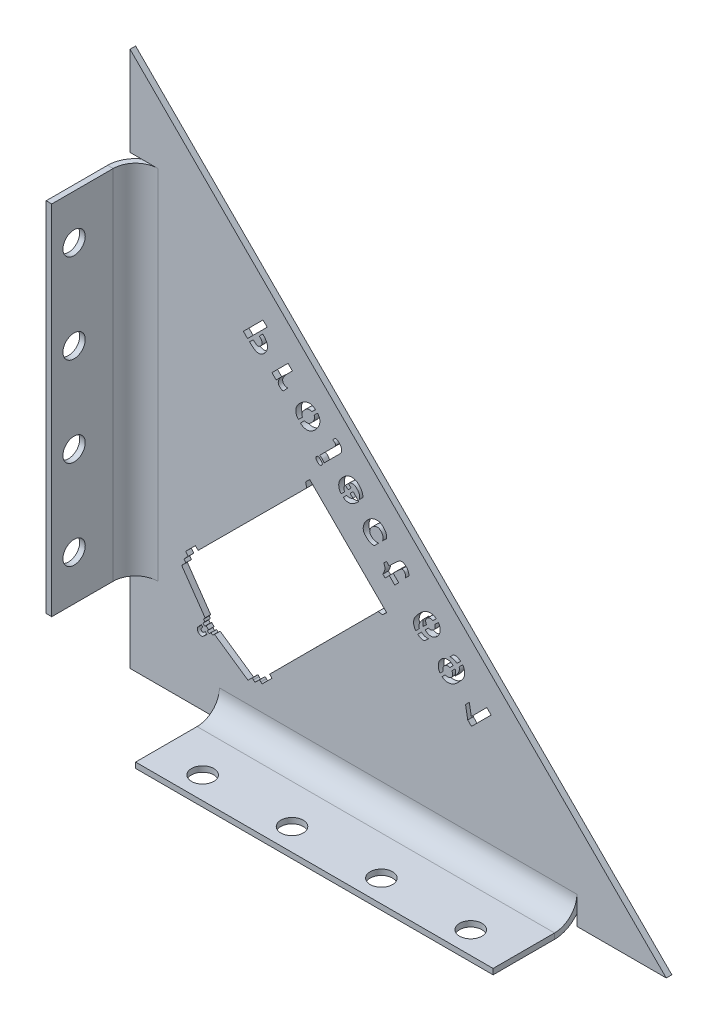
from build123d import *

# Parameters (mm, degrees)
BOSS_EXTRUDE1_DEPTH          = 1.5875
SKETCH7_W                    = 1.5875
SKETCH7_H                    = 101.6
BOSS_EXTRUDE2_DEPTH          = 0.0254
EDGE_FLANGE1_STRIP_W         = 19.05
EDGE_FLANGE1_STRIP_H         = 1.5875
EDGE_FLANGE1_STRIP_CUT_DEPTH = 101.6
EDGE_FLANGE1_DEPTH           = 101.6
SKETCH11_W                   = 101.6
SKETCH11_H                   = 1.5875
BOSS_EXTRUDE3_DEPTH          = 0.0254
EDGE_FLANGE2_STRIP_W         = 19.05
EDGE_FLANGE2_STRIP_H         = 1.5875
EDGE_FLANGE2_STRIP_CUT_DEPTH = 101.6
EDGE_FLANGE2_DEPTH           = 101.6
SKETCH15_R                   = 3.175
CUT_EXTRUDE1_DEPTH           = 2.54
SKETCH16_R                   = 3.175
CUT_EXTRUDE2_DEPTH           = 2.54
CUT_EXTRUDE4_DEPTH           = 2.54
CUT_EXTRUDE7_DEPTH           = 2.54
CUT_EXTRUDE11_DEPTH          = 2.54


# Sheet-metal steps are written as plain solids
with BuildPart() as part:
    # Sketch1 → Boss-Extrude1 (new body)
    with BuildSketch(Plane.XY):
        Polygon((0, 119.481843199), (0, -32.918156801), (152.4, -32.918156801), align=None)
    extrude(amount=BOSS_EXTRUDE1_DEPTH)

    # Sketch7 → Boss-Extrude2 (add)
    with BuildSketch(Plane.ZY):
        with Locations((0.79375, 43.281843199)):
            Rectangle(SKETCH7_W, SKETCH7_H)
    extrude(amount=BOSS_EXTRUDE2_DEPTH)

    # Edge-Flange1 strip (across the edge) → Edge-Flange1 strip cut (cut)
    with BuildSketch(Plane(origin=(-0.0254, 94.081843199, 1.5875), x_dir=(1, 0, 0), z_dir=(0, -1, 0))):
        with Locations((-1.5875, -0.79375)):
            Rectangle(EDGE_FLANGE1_STRIP_W, EDGE_FLANGE1_STRIP_H)
    extrude(amount=EDGE_FLANGE1_STRIP_CUT_DEPTH, mode=Mode.SUBTRACT)

    # Edge-Flange1 section (across the edge) → Edge-Flange1 (add)
    with BuildSketch(Plane(origin=(-0.0254, 94.081843199, 1.5875), x_dir=(1, 0, 0), z_dir=(0, -1, 0))):
        with BuildLine():
            Line((0, 6.35), (0, 23.8125))
            Line((0, 23.8125), (1.5875, 23.8125))
            Line((1.5875, 23.8125), (1.5875, 6.35))
            ThreePointArc((1.5875, 6.35), (3.447371939, 1.859871939), (7.9375, 0))
            Line((7.9375, 0), (7.9375, -1.5875))
            ThreePointArc((7.9375, -1.5875), (2.324839924, 0.737339924), (0, 6.35))
        make_face()
    extrude(amount=EDGE_FLANGE1_DEPTH)

    # Sketch11 → Boss-Extrude3 (add)
    with BuildSketch(Plane(origin=(0, -32.918156801, 0), x_dir=(-1, 0, 0), z_dir=(0, -1, 0))):
        with Locations((-76.2, -0.79375)):
            Rectangle(SKETCH11_W, SKETCH11_H)
    extrude(amount=BOSS_EXTRUDE3_DEPTH)

    # Edge-Flange2 strip (across the edge) → Edge-Flange2 strip cut (cut)
    with BuildSketch(Plane(origin=(25.4, -32.943556801, 1.5875), x_dir=(0, 1, 0), z_dir=(1, 0, 0))):
        with Locations((-1.5875, -0.79375)):
            Rectangle(EDGE_FLANGE2_STRIP_W, EDGE_FLANGE2_STRIP_H)
    extrude(amount=EDGE_FLANGE2_STRIP_CUT_DEPTH, mode=Mode.SUBTRACT)

    # Edge-Flange2 section (across the edge) → Edge-Flange2 (add)
    with BuildSketch(Plane(origin=(25.4, -32.943556801, 1.5875), x_dir=(0, 1, 0), z_dir=(1, 0, 0))):
        with BuildLine():
            Line((0, 6.35), (0, 23.8125))
            Line((0, 23.8125), (1.5875, 23.8125))
            Line((1.5875, 23.8125), (1.5875, 6.35))
            ThreePointArc((1.5875, 6.35), (3.447371939, 1.859871939), (7.9375, 0))
            Line((7.9375, 0), (7.9375, -1.5875))
            ThreePointArc((7.9375, -1.5875), (2.324839924, 0.737339924), (0, 6.35))
        make_face()
    extrude(amount=EDGE_FLANGE2_DEPTH)

    # Sketch15 → Cut-Extrude1 (cut)
    with BuildSketch(Plane(origin=(0, -31.356056801, 0), x_dir=(1, 0, 0), z_dir=(0, 1, 0))):
        with Locations(Location((38.1, -19.05, 0), (0, 0, 270))):
            Circle(SKETCH15_R)
        with Locations(Location((63.5, -19.05, 0), (0, 0, 270))):
            Circle(SKETCH15_R)
        with Locations(Location((88.9, -19.05, 0), (0, 0, 270))):
            Circle(SKETCH15_R)
        with Locations(Location((114.3, -19.05, 0), (0, 0, 270))):
            Circle(SKETCH15_R)
    extrude(amount=-CUT_EXTRUDE1_DEPTH, mode=Mode.SUBTRACT)

    # Sketch16 → Cut-Extrude2 (cut)
    with BuildSketch(Plane(origin=(1.5621, 0, 0), x_dir=(0, 0, -1), z_dir=(1, 0, 0))):
        with Locations((-19.05, 81.381843199)):
            Circle(SKETCH16_R)
        with Locations((-19.05, 55.981843199)):
            Circle(SKETCH16_R)
        with Locations((-19.05, 30.581843199)):
            Circle(SKETCH16_R)
        with Locations((-19.05, 5.181843199)):
            Circle(SKETCH16_R)
    extrude(amount=-CUT_EXTRUDE2_DEPTH, mode=Mode.SUBTRACT)

    # Sketch19 → Cut-Extrude4 (cut)
    with BuildSketch(Plane(origin=(0, 0, 0), x_dir=(-1, 0, 0), z_dir=(0, 0, -1))):
        with BuildLine():
            add(Edge.make_bspline(
                [(-54.451629709, 44.308400165), (-54.486216356, 44.347097669), (-54.552844966, 44.421645541), (-54.619431381, 44.554473369), (-54.644885888, 44.696657055), (-54.635652404, 44.845922248), (-54.586551979, 45.002877848), (-54.494039294, 45.164239512), (-54.370016404, 45.338062039), (-54.208899848, 45.506933329), (-54.038541356, 45.667558131), (-53.86728466, 45.796755143), (-53.705735912, 45.89260812), (-53.550339865, 45.947667342), (-53.401150145, 45.968395547), (-53.258558385, 45.944748504), (-53.125321358, 45.881598423), (-53.008521132, 45.783078955), (-52.908409106, 45.665084526), (-52.844147531, 45.525943286), (-52.818369511, 45.375023534), (-52.829681514, 45.214256535), (-52.880338366, 45.048503358), (-52.965261587, 44.877991305), (-53.089546945, 44.707389018), (-53.242168849, 44.54028881), (-53.406291032, 44.385842409), (-53.576008153, 44.2647164), (-53.738514348, 44.175383143), (-53.897071431, 44.122809093), (-54.050611902, 44.109146281), (-54.197235932, 44.13527054), (-54.333892833, 44.204126421), (-54.411237162, 44.272626479), (-54.451629709, 44.308400165)],
                knots=[0, 0, 0, 0, 0.89096093, 1.716370149, 2.519710242, 3.350237323, 4.268177873, 5.323688382, 6.539873258, 7.936784, 9.333694741, 10.567414482, 11.623893583, 12.554062634, 13.388976487, 14.188914126, 15.005781945, 15.896742875, 16.80159031, 17.649470878, 18.50136307, 19.41130979, 20.398285583, 21.466456066, 22.676900497, 24.018679477, 25.359804904, 26.548445057, 27.599284631, 28.541936938, 29.403380809, 30.226130366, 31.073608727, 32, 32, 32, 32], degree=3))
        make_face()
        Polygon((-97.041095461, 1.333701079), (-102.620099628, 6.912705246), (-101.390448586, 8.142356288), (-96.99810067, 3.750008371), (-96.421970461, 6.953980246), (-95.359139211, 5.891148996), (-95.98686317, 2.387933371), align=None)
        with BuildLine():
            Line((-93.953304581, 15.81339196), (-92.890473331, 14.75056071))
            add(Edge.make_bspline(
                [(-92.890473331, 14.75056071), (-92.827020703, 14.81059733), (-92.701447887, 14.929409864), (-92.492119234, 15.078359799), (-92.271478041, 15.202284832), (-92.037393519, 15.299625522), (-91.78672288, 15.368897662), (-91.518953423, 15.409021657), (-91.2324372, 15.423864597), (-91.036488157, 15.409695365), (-90.935070206, 15.402361752)],
                knots=[0, 0, 0, 0, 0.980817489, 1.941038821, 2.878509081, 3.820198868, 4.783140073, 5.793726477, 6.858092202, 8, 8, 8, 8], degree=3))
            Line((-90.935070206, 15.402361752), (-91.939428539, 16.406720085))
            add(Edge.make_bspline(
                [(-91.939428539, 16.406720085), (-91.993165972, 16.418939645), (-92.098857026, 16.442973138), (-92.258077532, 16.465620673), (-92.414584879, 16.474358391), (-92.568844285, 16.46923621), (-92.720262944, 16.450371927), (-92.868851097, 16.4176688), (-93.014099424, 16.370516387), (-93.198067554, 16.293917403), (-93.407190155, 16.189744697), (-93.627185453, 16.062698213), (-93.809767033, 15.943255505), (-93.908336009, 15.854076633), (-93.953304581, 15.81339196)],
                knots=[0, 0, 0, 0, 0.906066358, 1.782055884, 2.641294935, 3.480860537, 4.316978217, 5.147335385, 5.979189849, 6.824821184, 8.422826787, 9.816763711, 11.003976472, 12, 12, 12, 12], degree=3))
        make_face()
        with BuildLine():
            Line((-91.829361872, 13.689449252), (-90.900674372, 12.760761752))
            add(Edge.make_bspline(
                [(-90.900674372, 12.760761752), (-90.865046013, 12.778612267), (-90.786299141, 12.818066014), (-90.643909555, 12.853690463), (-90.471358878, 12.873514374), (-90.272722226, 12.884591741), (-90.054211337, 12.864226473), (-89.832377466, 12.782128668), (-89.616102321, 12.645750751), (-89.412378329, 12.464567674), (-89.229701124, 12.262953791), (-89.081677229, 12.05560123), (-88.978372056, 11.848737195), (-88.922837448, 11.643694736), (-88.90655937, 11.446448819), (-88.916750773, 11.259190232), (-88.961433038, 11.081178039), (-89.015975628, 10.974184384), (-89.043299372, 10.920584668)],
                knots=[0, 0, 0, 0, 0.572085397, 1.26444038, 2.09625672, 3.070483045, 4.124420694, 5.228059518, 6.43908216, 7.783856681, 9.138863522, 10.347129936, 11.439116606, 12.447625815, 13.383377729, 14.276112387, 15.136398451, 16, 16, 16, 16], degree=3))
            Line((-89.043299372, 10.920584668), (-88.123210831, 10.000496127))
            add(Edge.make_bspline(
                [(-88.123210831, 10.000496127), (-88.082613908, 10.04548828), (-88.000236962, 10.136783776), (-87.893894157, 10.292878584), (-87.809570633, 10.470904124), (-87.736046463, 10.66546123), (-87.683128216, 10.88049402), (-87.639940334, 11.113416514), (-87.620970711, 11.366235546), (-87.609935458, 11.632628123), (-87.623929923, 11.904280281), (-87.660394655, 12.17257981), (-87.72704783, 12.430825807), (-87.81613279, 12.681079235), (-87.934569663, 12.920789181), (-88.077536649, 13.152055351), (-88.247666053, 13.373173895), (-88.440077953, 13.581206228), (-88.645217386, 13.773318753), (-88.856778748, 13.942590593), (-89.071120764, 14.085769735), (-89.286140919, 14.206801892), (-89.50662817, 14.297554693), (-89.728506548, 14.366403101), (-89.95451886, 14.405135213), (-90.181072416, 14.421538348), (-90.40647744, 14.410248356), (-90.627217845, 14.37790837), (-90.842528353, 14.322683011), (-91.052166568, 14.242435821), (-91.256545267, 14.139011842), (-91.45560899, 14.012779996), (-91.647390526, 13.861639905), (-91.76774808, 13.747751393), (-91.829361872, 13.689449252)],
                knots=[0, 0, 0, 0, 0.749332702, 1.520502905, 2.326225067, 3.181293294, 4.089626218, 5.062179955, 6.108903827, 7.223051897, 8.359331748, 9.469748303, 10.567291151, 11.653221413, 12.75078718, 13.868789315, 15.012219258, 16.196922747, 17.371218932, 18.486698271, 19.545060865, 20.557780294, 21.533871024, 22.48975453, 23.426150137, 24.364585121, 25.294727598, 26.212564909, 27.120897833, 28.039063961, 28.98433606, 29.950480165, 30.950803785, 32, 32, 32, 32], degree=3))
        make_face()
        with BuildLine():
            add(Edge.make_bspline(
                [(-92.381414997, 13.137396127), (-92.401408019, 13.093668754), (-92.444054479, 13.000395323), (-92.488598898, 12.842843104), (-92.522393509, 12.662722038), (-92.545666044, 12.458206646), (-92.547858581, 12.224483646), (-92.51554026, 11.959650592), (-92.454557546, 11.662090246), (-92.395505671, 11.455065245), (-92.364217081, 11.34537321)],
                knots=[0, 0, 0, 0, 0.62829261, 1.340190433, 2.134471608, 3.024813884, 4.029827998, 5.184373668, 6.508142579, 8, 8, 8, 8], degree=3))
            add(Edge.make_bspline(
                [(-92.364217081, 11.34537321), (-92.431804593, 11.42117066), (-92.563634646, 11.569014269), (-92.748121922, 11.793046799), (-92.915441014, 12.013116992), (-93.064818903, 12.229703559), (-93.198429474, 12.441453372), (-93.313406893, 12.650347094), (-93.414677041, 12.854223543), (-93.493931047, 13.054527701), (-93.558434918, 13.244258279), (-93.603360511, 13.42132269), (-93.631244629, 13.583577491), (-93.635970005, 13.730845421), (-93.626231495, 13.864138642), (-93.59259236, 13.981852104), (-93.54348607, 14.087966721), (-93.493338721, 14.144506523), (-93.468323331, 14.17271071)],
                knots=[0, 0, 0, 0, 1.505393456, 2.936283515, 4.301144198, 5.602399503, 6.835634825, 8.011059706, 9.136095676, 10.2076363, 11.201985935, 12.104778921, 12.913735962, 13.636550114, 14.285162681, 14.885188552, 15.443889973, 16, 16, 16, 16], degree=3))
            Line((-93.468323331, 14.17271071), (-94.531154581, 15.23554196))
            add(Edge.make_bspline(
                [(-94.531154581, 15.23554196), (-94.546476559, 15.21925938), (-94.580136534, 15.183489113), (-94.624866186, 15.11754167), (-94.672730646, 15.039624409), (-94.725803286, 14.950321381), (-94.775106416, 14.844714445), (-94.83180932, 14.72845939), (-94.885241563, 14.596498155), (-94.964591032, 14.406586498), (-95.045562833, 14.15489064), (-95.10878384, 13.843435317), (-95.131915164, 13.525834903), (-95.120967072, 13.203011404), (-95.066775254, 12.87590739), (-94.968828804, 12.545691483), (-94.825629337, 12.214192568), (-94.674673474, 11.935822206), (-94.524157913, 11.70728388), (-94.388298876, 11.518439466), (-94.229532141, 11.315716781), (-94.048702919, 11.099068762), (-93.845366575, 10.869371199), (-93.621299048, 10.623896683), (-93.373454466, 10.365993214), (-93.111686754, 10.095666169), (-92.835532734, 9.834252467), (-92.549409162, 9.597323297), (-92.258512522, 9.390408532), (-91.964110859, 9.21282349), (-91.666761888, 9.063154132), (-91.36462485, 8.943783402), (-91.058274232, 8.854461593), (-90.750957517, 8.793542436), (-90.448500585, 8.765001506), (-90.156853799, 8.763232258), (-89.878878069, 8.794850197), (-89.614090896, 8.854300056), (-89.362594349, 8.946160682), (-89.126084254, 9.069236092), (-88.902988468, 9.221746894), (-88.769059657, 9.34358707), (-88.701060831, 9.40544821)],
                knots=[0, 0, 0, 0, 0.246047121, 0.54052682, 0.875339091, 1.254582366, 1.684013454, 2.158772054, 2.679702756, 3.252169111, 4.426864954, 5.586482217, 6.745910187, 7.928056321, 9.137963352, 10.389281836, 11.713984913, 13.110531903, 13.87271873, 14.728252196, 15.673472726, 16.709591897, 17.837528405, 19.053719, 20.371838385, 21.778989529, 23.200179869, 24.559848916, 25.869219826, 27.130291179, 28.345102835, 29.533444252, 30.704908277, 31.857102753, 32.980394827, 34.048003767, 35.06513386, 36.056634424, 37.031902402, 38.006679225, 38.987943888, 40, 40, 40, 40], degree=3))
            Line((-88.701060831, 9.40544821), (-89.629748331, 10.33413571))
            add(Edge.make_bspline(
                [(-89.629748331, 10.33413571), (-89.667487721, 10.303972747), (-89.750294481, 10.237789978), (-89.916911043, 10.177856954), (-90.121639488, 10.141549584), (-90.315636636, 10.125537564), (-90.483888708, 10.128606499), (-90.611927818, 10.146088424), (-90.736579024, 10.177041387), (-90.857187765, 10.222539547), (-90.975133653, 10.27927401), (-91.089030024, 10.35050112), (-91.199480749, 10.435279992), (-91.304338185, 10.532368431), (-91.401669469, 10.636673511), (-91.483896193, 10.748005897), (-91.555569602, 10.859843007), (-91.613311908, 10.975374478), (-91.653794574, 11.095501683), (-91.684556654, 11.217806572), (-91.697059713, 11.343923344), (-91.699148886, 11.509206567), (-91.678715482, 11.702608574), (-91.632770637, 11.909392159), (-91.564301943, 12.083441729), (-91.494334179, 12.174398274), (-91.461326456, 12.217307585)],
                knots=[0, 0, 0, 0, 0.941398391, 2.065591195, 3.415888152, 5.015585384, 5.869499527, 6.708209235, 7.541789172, 8.38049888, 9.229449441, 10.102141201, 11.007470802, 11.953414455, 12.899358108, 13.797904023, 14.661075357, 15.499935466, 16.320473825, 17.1404739, 17.965305893, 18.796536752, 20.376834823, 21.76085807, 22.943670992, 24, 24, 24, 24], degree=3))
            Line((-91.461326456, 12.217307585), (-92.381414997, 13.137396127))
        make_face()
        with BuildLine():
            add(Edge.make_bspline(
                [(-82.835806409, 17.444519299), (-82.899276743, 17.384517912), (-83.024884601, 17.265775107), (-83.234365557, 17.116022379), (-83.456635712, 16.993714048), (-83.690121662, 16.893140388), (-83.941359555, 16.824782847), (-84.209539563, 16.783621475), (-84.496772528, 16.771872643), (-84.693243474, 16.785621819), (-84.794649117, 16.792718257)],
                knots=[0, 0, 0, 0, 0.979072112, 1.937584718, 2.879005898, 3.821503001, 4.78273064, 5.791518692, 6.860124242, 8, 8, 8, 8], degree=3))
            Line((-84.794649117, 16.792718257), (-83.790290784, 15.788359924))
            add(Edge.make_bspline(
                [(-83.790290784, 15.788359924), (-83.736553267, 15.776140095), (-83.630862048, 15.752106074), (-83.471642739, 15.729462378), (-83.315130996, 15.72071055), (-83.160887569, 15.725884025), (-83.00940992, 15.744558952), (-82.861208896, 15.777926107), (-82.71529998, 15.822374328), (-82.53093164, 15.899848018), (-82.322187091, 16.005602228), (-82.099535947, 16.130639576), (-81.917237408, 16.251493961), (-81.817985241, 16.341067258), (-81.772975159, 16.381688049)],
                knots=[0, 0, 0, 0, 0.904693802, 1.779356334, 2.637293765, 3.475587551, 4.310438636, 5.139537936, 5.967300108, 6.811650437, 8.419848378, 9.806986057, 11.0054853, 12, 12, 12, 12], degree=3))
            Line((-81.772975159, 16.381688049), (-82.835806409, 17.444519299))
        make_face()
        with BuildLine():
            add(Edge.make_bspline(
                [(-84.827325159, 19.436038049), (-84.854564989, 19.416011652), (-84.917873529, 19.369467973), (-85.051622074, 19.336000663), (-85.222401135, 19.313369317), (-85.390322439, 19.305807729), (-85.538844038, 19.313379107), (-85.654314521, 19.33259974), (-85.768038128, 19.365369098), (-85.880772719, 19.412722561), (-85.991897258, 19.472673176), (-86.101555887, 19.546191287), (-86.209251038, 19.632330901), (-86.314707258, 19.728622122), (-86.412016616, 19.834446058), (-86.497697852, 19.945576316), (-86.570635578, 20.060199473), (-86.63154299, 20.177218872), (-86.678216999, 20.298346281), (-86.711251917, 20.422905492), (-86.729741686, 20.551014973), (-86.73636408, 20.67882448), (-86.732295804, 20.800401531), (-86.732199117, 20.910531316), (-86.726915331, 21.006336768), (-86.719387485, 21.087024179), (-86.714040591, 21.153453017), (-86.703536642, 21.204403556), (-86.6931487, 21.242501832), (-86.681042255, 21.260337021), (-86.6761012, 21.267616174)],
                knots=[0, 0, 0, 0, 0.85560708, 1.988530585, 3.450300191, 5.264639633, 6.260510601, 7.238733058, 8.242833179, 9.271849073, 10.351149459, 11.458117423, 12.633996484, 13.865282824, 15.096569164, 16.295489222, 17.439209424, 18.557320352, 19.654201837, 20.742868331, 21.836627571, 22.949277022, 24.002010568, 24.937797688, 25.757685454, 26.447304249, 27.005929431, 27.453212033, 27.776837077, 28, 28, 28, 28], degree=3))
            Line((-86.6761012, 21.267616174), (-87.596189742, 22.187704716))
            add(Edge.make_bspline(
                [(-87.596189742, 22.187704716), (-87.637728652, 22.14296701), (-87.721860968, 22.0523559), (-87.823727289, 21.893035781), (-87.912848886, 21.717662182), (-87.984190299, 21.522284359), (-88.040709462, 21.308092454), (-88.081368704, 21.075064093), (-88.106985863, 20.823367105), (-88.115231911, 20.55732204), (-88.105093864, 20.286098857), (-88.066690875, 20.019394393), (-88.00360697, 19.761297398), (-87.910808177, 19.51319339), (-87.795838463, 19.271960291), (-87.651786714, 19.041979957), (-87.484019898, 18.819577756), (-87.291221465, 18.612266303), (-87.08629021, 18.41995225), (-86.874529132, 18.251001171), (-86.660556892, 18.106679856), (-86.443395396, 17.989088161), (-86.223192969, 17.897339708), (-86.0011858, 17.828722992), (-85.775209653, 17.789940142), (-85.54863697, 17.773514425), (-85.323272028, 17.784943402), (-85.101699225, 17.816859237), (-84.886247078, 17.874327814), (-84.67579939, 17.954236263), (-84.471463579, 18.057823395), (-84.272387939, 18.184009906), (-84.080609703, 18.335162549), (-83.960251688, 18.449049306), (-83.898637659, 18.507350549)],
                knots=[0, 0, 0, 0, 0.754218705, 1.527583814, 2.330364635, 3.185698592, 4.096112628, 5.068968605, 6.110304904, 7.224799218, 8.361099975, 9.464837378, 10.55411321, 11.642811209, 12.737618736, 13.855968312, 14.995454345, 16.180526003, 17.355187124, 18.471013122, 19.529704623, 20.545567307, 21.521961377, 22.478141943, 23.414828553, 24.353555175, 25.283986712, 26.20210926, 27.119381554, 28.03783302, 28.983398881, 29.949843235, 30.950477726, 32, 32, 32, 32], degree=3))
            Line((-83.898637659, 18.507350549), (-84.827325159, 19.436038049))
        make_face()
        with BuildLine():
            Line((-87.002861617, 22.798230757), (-86.082773075, 21.878142216))
            add(Edge.make_bspline(
                [(-86.082773075, 21.878142216), (-86.044871819, 21.905930097), (-85.960944985, 21.967462329), (-85.795847099, 22.020790953), (-85.593785164, 22.057947286), (-85.401441526, 22.069670037), (-85.233761598, 22.070616466), (-85.106494158, 22.052079461), (-84.98244418, 22.022979749), (-84.861844006, 21.979782755), (-84.744377551, 21.922487015), (-84.630501994, 21.852040666), (-84.521577106, 21.766029622), (-84.416608609, 21.669757196), (-84.320167289, 21.565314289), (-84.236117771, 21.455302533), (-84.166067973, 21.342327166), (-84.107940027, 21.226601503), (-84.066573427, 21.106725659), (-84.039779282, 20.984300568), (-84.022589608, 20.858810508), (-84.025326256, 20.69323029), (-84.044069242, 20.500179566), (-84.088299276, 20.293540468), (-84.156881026, 20.120257674), (-84.226806252, 20.029287244), (-84.259793909, 19.986371382)],
                knots=[0, 0, 0, 0, 0.920246832, 2.037753089, 3.370223432, 4.965495549, 5.823278378, 6.666006617, 7.489935579, 8.328801025, 9.181819185, 10.058692295, 10.959424894, 11.90990087, 12.860376847, 13.754225126, 14.631098236, 15.473977597, 16.298447423, 17.1198218, 17.938711394, 18.78513434, 20.373004133, 21.750129612, 22.938609776, 24, 24, 24, 24], degree=3))
            Line((-84.259793909, 19.986371382), (-83.339705367, 19.066282841))
            add(Edge.make_bspline(
                [(-83.339705367, 19.066282841), (-83.337314023, 19.070825874), (-83.329849873, 19.085006136), (-83.320709741, 19.115741412), (-83.310995106, 19.16244899), (-83.299460155, 19.224596971), (-83.282656563, 19.302099147), (-83.269007958, 19.396648977), (-83.248774741, 19.506306227), (-83.223146292, 19.67714832), (-83.200083667, 19.911374552), (-83.214468037, 20.211186826), (-83.265055902, 20.529873402), (-83.324327096, 20.744731513), (-83.355183492, 20.856585966)],
                knots=[0, 0, 0, 0, 0.101550044, 0.316970218, 0.630996386, 1.047382525, 1.568414415, 2.201169797, 2.938457384, 3.776629817, 5.622774983, 7.588561941, 9.703419321, 12, 12, 12, 12], degree=3))
            add(Edge.make_bspline(
                [(-83.355183492, 20.856585966), (-83.287303255, 20.781607125), (-83.154573218, 20.634996792), (-82.973627848, 20.408484908), (-82.806184355, 20.189093034), (-82.655239839, 19.973520094), (-82.523259363, 19.76072166), (-82.407628428, 19.551664722), (-82.306470336, 19.347722247), (-82.227162937, 19.147435536), (-82.162757197, 18.957697243), (-82.117532783, 18.780646007), (-82.090589978, 18.618328731), (-82.082877984, 18.471160091), (-82.093298383, 18.337815205), (-82.126777427, 18.22010834), (-82.175921929, 18.113992148), (-82.226064323, 18.057452551), (-82.251077242, 18.029248466)],
                knots=[0, 0, 0, 0, 1.499452607, 2.931963819, 4.297215525, 5.591857327, 6.832659565, 8.008421198, 9.133779482, 10.205627096, 11.200261605, 12.103313234, 12.912502037, 13.635873002, 14.284671392, 14.884869166, 15.443730651, 16, 16, 16, 16], degree=3))
            Line((-82.251077242, 18.029248466), (-81.19684495, 16.957818257))
            add(Edge.make_bspline(
                [(-81.19684495, 16.957818257), (-81.164179404, 16.996563853), (-81.088849575, 17.08591485), (-80.991285161, 17.260333751), (-80.882860731, 17.48277451), (-80.773383265, 17.749701653), (-80.672485601, 18.045286858), (-80.611242392, 18.358091752), (-80.586771431, 18.676129746), (-80.600765441, 18.998929363), (-80.65448586, 19.326522356), (-80.751584996, 19.657118322), (-80.896008538, 19.988117314), (-81.046402267, 20.266159075), (-81.196986602, 20.494658721), (-81.332746952, 20.683579992), (-81.491674328, 20.885698052), (-81.670617264, 21.103423202), (-81.874019484, 21.333142335), (-82.099990598, 21.576828175), (-82.345764815, 21.837238665), (-82.609503672, 22.105690072), (-82.88609003, 22.367630819), (-83.171070382, 22.606614143), (-83.462561002, 22.812380504), (-83.755350527, 22.992364129), (-84.05416074, 23.137380642), (-84.354335763, 23.258746111), (-84.660045603, 23.346085515), (-84.966337587, 23.404124193), (-85.26746366, 23.434548396), (-85.557815343, 23.432156697), (-85.834419011, 23.404782844), (-86.097276399, 23.343805937), (-86.346098962, 23.252122688), (-86.581290615, 23.131118465), (-86.802632384, 22.980202934), (-86.935431491, 22.859512552), (-87.002861617, 22.798230757)],
                knots=[0, 0, 0, 0, 0.502037088, 1.157744874, 1.97454839, 2.959285973, 4.01902647, 5.069008332, 6.113240045, 7.17816074, 8.267856111, 9.400307047, 10.588158337, 11.845949846, 12.532408751, 13.302939737, 14.15424683, 15.083789136, 16.099658256, 17.198862789, 18.382099562, 19.653432753, 20.933419144, 22.161626123, 23.340903029, 24.471809323, 25.568493029, 26.633474518, 27.681496838, 28.718136979, 29.724159769, 30.680022608, 31.595476004, 32.477375997, 33.350403549, 34.220664323, 35.096523834, 36, 36, 36, 36], degree=3))
        make_face()
        with BuildLine():
            Line((-73.676579668, 26.78948354), (-75.248469251, 25.217593956))
            Line((-75.248469251, 25.217593956), (-76.368053626, 26.337178331))
            Line((-76.368053626, 26.337178331), (-74.778966126, 27.926265831))
            add(Edge.make_bspline(
                [(-74.778966126, 27.926265831), (-74.864319861, 28.011744827), (-75.030158668, 28.177827012), (-75.272647007, 28.418604234), (-75.501402091, 28.643877587), (-75.715853685, 28.85366241), (-75.917456305, 29.047077221), (-76.106610855, 29.223023373), (-76.28020712, 29.386048067), (-76.441946532, 29.531534914), (-76.589042036, 29.662623033), (-76.723741565, 29.776103607), (-76.844092482, 29.874945753), (-76.951361241, 29.956991361), (-77.045614583, 30.023286358), (-77.125035179, 30.07540189), (-77.192322812, 30.111019777), (-77.263485507, 30.136710415), (-77.344390906, 30.14830907), (-77.437539133, 30.15068767), (-77.529790866, 30.138417449), (-77.620568148, 30.111883346), (-77.71061434, 30.071702526), (-77.799648895, 30.018005765), (-77.888651692, 29.951548654), (-77.976018828, 29.871668108), (-78.05808797, 29.774150407), (-78.129955402, 29.657378377), (-78.194077286, 29.522114944), (-78.246190167, 29.367178227), (-78.288858371, 29.193329621), (-78.323199418, 29.000368673), (-78.346420492, 28.787739741), (-78.35508239, 28.639454153), (-78.359572376, 28.562588748)],
                knots=[0, 0, 0, 0, 2.101008207, 4.082172786, 5.943522058, 7.68509019, 9.300008141, 10.802546222, 12.178252559, 13.441861742, 14.586194535, 15.604965906, 16.505040786, 17.294744402, 17.953113938, 18.509065358, 18.94607414, 19.274048666, 19.819894317, 20.358405463, 20.891442757, 21.431060434, 21.997990298, 22.601610091, 23.235750963, 23.927261849, 24.656216208, 25.444659925, 26.305439678, 27.254545304, 28.282303508, 29.416689186, 30.660913489, 32, 32, 32, 32], degree=3))
            Line((-78.359572376, 28.562588748), (-79.279660918, 29.48267729))
            add(Edge.make_bspline(
                [(-79.279660918, 29.48267729), (-79.277684024, 29.575693828), (-79.273784669, 29.759165731), (-79.232633413, 30.029533805), (-79.165981726, 30.290287669), (-79.070331564, 30.541580716), (-78.947286758, 30.783506831), (-78.796753855, 31.017241448), (-78.616905654, 31.240247072), (-78.415692061, 31.449896022), (-78.202433377, 31.636793464), (-77.983747097, 31.787833665), (-77.766174911, 31.900335171), (-77.549912852, 31.975985062), (-77.332561346, 32.004703505), (-77.117012354, 31.996636987), (-76.90316316, 31.947320402), (-76.727955916, 31.872267016), (-76.584859352, 31.790456477), (-76.464467616, 31.714551041), (-76.333215708, 31.624337075), (-76.190667652, 31.519764581), (-76.038213846, 31.398359479), (-75.873190064, 31.265466151), (-75.69901299, 31.115471421), (-75.511643401, 30.953902194), (-75.316198406, 30.773615083), (-75.108070149, 30.58104754), (-74.887475822, 30.375759857), (-74.658973336, 30.151859034), (-74.416774593, 29.916545418), (-74.166008807, 29.663964911), (-73.902095978, 29.399881274), (-73.724502416, 29.216910956), (-73.633584876, 29.123240831)],
                knots=[0, 0, 0, 0, 1.085389273, 2.140892794, 3.184807694, 4.222868981, 5.273607416, 6.348647858, 7.463021242, 8.61342064, 9.738059799, 10.768496461, 11.708500936, 12.591179862, 13.428961146, 14.252964721, 15.097351619, 15.976291711, 16.467810808, 17.02124563, 17.637646695, 18.327129035, 19.085054335, 19.913017793, 20.800960146, 21.768794264, 22.801706426, 23.905353264, 25.079785544, 26.320015897, 27.64064166, 29.02272206, 30.475807449, 32, 32, 32, 32], degree=3))
            Line((-73.633584876, 29.123240831), (-72.880316126, 29.859311665))
            Line((-72.880316126, 29.859311665), (-72.085772376, 29.064767915))
            add(Edge.make_bspline(
                [(-72.085772376, 29.064767915), (-72.121749229, 29.002823226), (-72.192004912, 28.881857493), (-72.278150882, 28.695332957), (-72.345373849, 28.510505915), (-72.396384284, 28.327855224), (-72.427013076, 28.146260973), (-72.44151049, 27.966667482), (-72.436686788, 27.7883895), (-72.40196749, 27.552955027), (-72.331148337, 27.258503346), (-72.209145653, 26.907688681), (-72.055083542, 26.554596325), (-71.926222577, 26.32749645), (-71.860479668, 26.21163354)],
                knots=[0, 0, 0, 0, 0.849700362, 1.659296869, 2.434018451, 3.181594192, 3.906287857, 4.615849473, 5.316815592, 6.017187309, 7.436196407, 8.903354277, 10.420138338, 12, 12, 12, 12], degree=3))
            Line((-71.860479668, 26.21163354), (-72.496802585, 25.558112706))
            Line((-72.496802585, 25.558112706), (-73.676579668, 26.78948354))
        make_face()
        with BuildLine():
            add(Edge.make_bspline(
                [(-70.665807659, 33.263915965), (-70.562760443, 33.252037362), (-70.362822022, 33.228989779), (-70.069553807, 33.230508319), (-69.793365107, 33.254764939), (-69.530581552, 33.309076544), (-69.278293944, 33.40285238), (-69.031336708, 33.535185854), (-68.790526611, 33.711997156), (-68.596899653, 33.88638437), (-68.451800541, 34.04324844), (-68.355775827, 34.169067301), (-68.278988257, 34.302123908), (-68.216129236, 34.438968129), (-68.168978121, 34.580668906), (-68.140159518, 34.728065952), (-68.12649751, 34.880205669), (-68.128037312, 35.036421709), (-68.14699774, 35.195704102), (-68.184925741, 35.355560881), (-68.242529771, 35.515108981), (-68.319202836, 35.673397039), (-68.412397493, 35.832512794), (-68.525076568, 35.990876212), (-68.656290947, 36.149365174), (-68.803866117, 36.303887983), (-68.95839307, 36.452243638), (-69.119760141, 36.58235344), (-69.279138062, 36.699763794), (-69.442610886, 36.795678686), (-69.606800682, 36.873518925), (-69.771729796, 36.93494634), (-69.938379149, 36.977732522), (-70.105411177, 37.00352656), (-70.269749386, 37.013136141), (-70.429380249, 37.001781897), (-70.582975156, 36.976775007), (-70.731211595, 36.933649935), (-70.872213322, 36.87031901), (-71.009846996, 36.793000553), (-71.139972684, 36.696039775), (-71.3019681, 36.547956472), (-71.480681109, 36.350175532), (-71.65409143, 36.100194497), (-71.788150701, 35.849492967), (-71.869523943, 35.588449349), (-71.910561838, 35.316606014), (-71.916645136, 35.028319334), (-71.885929835, 34.719405039), (-71.842439388, 34.509845196), (-71.819787867, 34.400698257)],
                knots=[0, 0, 0, 0, 1.470542692, 2.853235619, 4.152202258, 5.39967885, 6.647712132, 7.957683506, 9.361764752, 10.87618873, 11.647627645, 12.39103021, 13.116416951, 13.822532992, 14.524703169, 15.229740991, 15.948439463, 16.688631542, 17.442242091, 18.219532929, 19.01449555, 19.84395181, 20.711608562, 21.62780905, 22.598390114, 23.628264403, 24.658138692, 25.635004099, 26.56727354, 27.464209558, 28.319193501, 29.14264638, 29.95737668, 30.755702436, 31.537575595, 32.287446119, 33.021535637, 33.742164492, 34.470554541, 35.210031285, 35.977860104, 36.766808421, 38.321730491, 39.747668001, 41.075445872, 42.338443232, 43.60611978, 44.964801815, 46.419150403, 48, 48, 48, 48], degree=3))
            Line((-71.819787867, 34.400698257), (-72.9066962, 35.48760659))
            add(Edge.make_bspline(
                [(-72.9066962, 35.48760659), (-72.918403373, 35.597526674), (-72.941113068, 35.810750792), (-72.932486466, 36.12459628), (-72.886513319, 36.420252806), (-72.815030334, 36.655213408), (-72.734923711, 36.839710279), (-72.653846777, 36.984834676), (-72.556121447, 37.138603736), (-72.440162007, 37.301536665), (-72.303485881, 37.470503893), (-72.150988031, 37.649435879), (-71.978786024, 37.835771097), (-71.793814658, 38.02884106), (-71.591874686, 38.212972326), (-71.369838873, 38.36712655), (-71.134167828, 38.490357197), (-70.885164798, 38.582313013), (-70.622518912, 38.640652254), (-70.347169591, 38.667792965), (-70.058285893, 38.663666414), (-69.759713142, 38.628188795), (-69.458069193, 38.567296516), (-69.161438791, 38.47890012), (-68.872825304, 38.366467245), (-68.591705191, 38.229991472), (-68.317928967, 38.069730001), (-68.05182567, 37.885139149), (-67.79558304, 37.673777885), (-67.548653467, 37.442177007), (-67.316980236, 37.19483224), (-67.104464415, 36.938885985), (-66.916609633, 36.674626436), (-66.750655611, 36.404515618), (-66.608519018, 36.126448064), (-66.492212131, 35.840575799), (-66.396856662, 35.548175619), (-66.324311008, 35.252405278), (-66.281384453, 34.958191472), (-66.267151685, 34.673262212), (-66.290205534, 34.401252182), (-66.343401906, 34.141606684), (-66.429628487, 33.894356847), (-66.549625019, 33.660209375), (-66.702652856, 33.439562508), (-66.886236201, 33.238789404), (-67.078124014, 33.053259011), (-67.262147287, 32.879956112), (-67.436977676, 32.726256918), (-67.600292683, 32.588673652), (-67.755471447, 32.472111936), (-67.89997259, 32.371214156), (-68.034830812, 32.288871828), (-68.204181552, 32.200440307), (-68.431097553, 32.122625724), (-68.729214646, 32.057166199), (-69.066238737, 32.024243891), (-69.303104199, 32.025176143), (-69.427557659, 32.025665965)],
                knots=[0, 0, 0, 0, 1.212110388, 2.351264303, 3.43418508, 4.486934378, 5.036295743, 5.638814002, 6.309033391, 7.0352594, 7.832092646, 8.693261309, 9.614991124, 10.61601471, 11.627501145, 12.608313668, 13.573505734, 14.538861815, 15.512627365, 16.517990897, 17.568708004, 18.676846608, 19.813200097, 20.941864807, 22.069283915, 23.208854694, 24.367712417, 25.547471964, 26.759010776, 28.009707902, 29.260405029, 30.475939234, 31.657793749, 32.815540923, 33.952242666, 35.080819703, 36.198932209, 37.325051617, 38.418520337, 39.457513304, 40.448622668, 41.406094968, 42.359154594, 43.312982207, 44.28503911, 45.296525545, 46.293051283, 47.214437506, 48.070234978, 48.847556726, 49.557216224, 50.199418809, 50.780978401, 51.290260338, 52.293239224, 53.401431403, 54.634664375, 56, 56, 56, 56], degree=3))
            Line((-69.427557659, 32.025665965), (-70.665807659, 33.263915965))
        make_face()
        with BuildLine():
            Line((-63.401519343, 42.299589698), (-62.548502676, 41.446573032))
            Line((-62.548502676, 41.446573032), (-63.351645384, 40.643430323))
            add(Edge.make_bspline(
                [(-63.351645384, 40.643430323), (-63.304360757, 40.61370488), (-63.212333688, 40.555852138), (-63.072800746, 40.479358302), (-62.934567394, 40.417256523), (-62.799351919, 40.367874781), (-62.667603834, 40.328360544), (-62.537825131, 40.30491795), (-62.410618932, 40.291612896), (-62.251053308, 40.295901256), (-62.069812359, 40.313887183), (-61.88108504, 40.357673299), (-61.724858037, 40.416113146), (-61.647249335, 40.479743496), (-61.611216218, 40.509286573)],
                knots=[0, 0, 0, 0, 1.080366058, 2.102647872, 3.075552691, 4.008840917, 4.886296197, 5.732425285, 6.556760715, 7.355329272, 8.816413178, 10.069944751, 11.103890339, 12, 12, 12, 12], degree=3))
            Line((-61.611216218, 40.509286573), (-60.617176634, 39.498049073))
            add(Edge.make_bspline(
                [(-60.617176634, 39.498049073), (-60.668273435, 39.450895769), (-60.770606065, 39.356460861), (-60.944637246, 39.237298725), (-61.134430461, 39.139470392), (-61.339965817, 39.06165164), (-61.561170837, 39.003097771), (-61.79861591, 38.965869829), (-62.051775554, 38.949966253), (-62.271904655, 38.950037668), (-62.456535531, 38.964390765), (-62.600650285, 38.991345384), (-62.749229148, 39.028779074), (-62.900535465, 39.081252228), (-63.055853567, 39.145559817), (-63.216040777, 39.220761266), (-63.378915362, 39.311073185), (-63.54647923, 39.412307853), (-63.716319603, 39.528749192), (-63.89148992, 39.654980977), (-64.069450109, 39.795547276), (-64.251037146, 39.948983702), (-64.439050151, 40.112921145), (-64.627475867, 40.293376362), (-64.822198556, 40.483368639), (-64.950823378, 40.616716768), (-65.016403718, 40.684705323)],
                knots=[0, 0, 0, 0, 0.978268325, 1.959198429, 2.959475274, 3.979115361, 5.048404036, 6.176663684, 7.358206194, 8.61775121, 9.274169846, 9.963100784, 10.679810482, 11.430460591, 12.216116228, 13.046780638, 13.921181679, 14.837838197, 15.802991469, 16.820423536, 17.878373968, 18.99586468, 20.168574398, 21.390794942, 22.669677026, 24, 24, 24, 24], degree=3))
            Line((-65.016403718, 40.684705323), (-63.401519343, 42.299589698))
        make_face()
        with BuildLine():
            add(Edge.make_bspline(
                [(-66.161784968, 42.215319907), (-66.163877608, 42.337502818), (-66.167956764, 42.575672401), (-66.129426329, 42.923170677), (-66.055364462, 43.249225865), (-65.963580178, 43.508037312), (-65.863454342, 43.707555353), (-65.77451573, 43.864505927), (-65.665885886, 44.025942197), (-65.544833609, 44.1964344), (-65.404879256, 44.371693249), (-65.247140802, 44.552532024), (-65.073989582, 44.740664889), (-64.888533858, 44.933820171), (-64.687981215, 45.117811057), (-64.468224618, 45.27469356), (-64.235313174, 45.405157535), (-63.989275167, 45.509062138), (-63.728495655, 45.582267425), (-63.456136082, 45.631585316), (-63.16957922, 45.648482458), (-62.872451887, 45.642819932), (-62.569147295, 45.605044319), (-62.265617859, 45.534340994), (-61.965970504, 45.427186481), (-61.66615559, 45.292149764), (-61.372627768, 45.117116682), (-61.078504642, 44.913846295), (-60.788322862, 44.67547397), (-60.506210944, 44.408964544), (-60.240114469, 44.127514321), (-60.003298203, 43.838215548), (-59.800841888, 43.546984896), (-59.632145402, 43.253434116), (-59.499398774, 42.957169269), (-59.399650436, 42.658970285), (-59.3355264, 42.358951849), (-59.307258159, 42.059477916), (-59.307446926, 41.767031613), (-59.332464794, 41.485327265), (-59.384477038, 41.217571178), (-59.459832523, 40.963019964), (-59.561347, 40.722634106), (-59.690649161, 40.497281681), (-59.843255767, 40.284318297), (-59.963316294, 40.156048414), (-60.023848509, 40.091377198)],
                knots=[0, 0, 0, 0, 1.250245971, 2.437088431, 3.569076056, 4.668313061, 5.237939865, 5.853132467, 6.514085654, 7.229170028, 7.99368854, 8.809250996, 9.68579403, 10.611430026, 11.550754987, 12.467809102, 13.369156445, 14.279404135, 15.195311684, 16.137164031, 17.107803571, 18.129389843, 19.176309578, 20.231310085, 21.313569498, 22.429880817, 23.592616785, 24.807276671, 26.087947032, 27.433335938, 28.778724844, 30.05113656, 31.257628516, 32.40647363, 33.512600023, 34.576170705, 35.620322463, 36.64650182, 37.650209355, 38.6110024, 39.537679983, 40.438339042, 41.324673318, 42.202689056, 43.093830289, 44, 44, 44, 44], degree=3))
            Line((-60.023848509, 40.091377198), (-61.026487051, 41.09401574))
            add(Edge.make_bspline(
                [(-61.026487051, 41.09401574), (-60.996895371, 41.130038217), (-60.931666921, 41.209441967), (-60.874057616, 41.369965608), (-60.826727573, 41.564945531), (-60.808032836, 41.752183095), (-60.803444134, 41.916374587), (-60.817437647, 42.044174716), (-60.847994008, 42.169803397), (-60.888427024, 42.295896446), (-60.948720032, 42.419197983), (-61.020405492, 42.543705123), (-61.109210465, 42.665961798), (-61.176132318, 42.744323014), (-61.210504759, 42.784570948)],
                knots=[0, 0, 0, 0, 0.903544933, 1.991669157, 3.279951243, 4.821064787, 5.648621548, 6.480924246, 7.319065636, 8.167733314, 9.058104403, 9.990191133, 10.967720779, 12, 12, 12, 12], degree=3))
            Line((-61.210504759, 42.784570948), (-61.963773509, 42.031302198))
            Line((-61.963773509, 42.031302198), (-62.816790176, 42.884318865))
            Line((-62.816790176, 42.884318865), (-62.080719343, 43.620389698))
            add(Edge.make_bspline(
                [(-62.080719343, 43.620389698), (-62.130513051, 43.665864107), (-62.227734248, 43.754651959), (-62.379992971, 43.871139069), (-62.533152518, 43.968755494), (-62.68515911, 44.048346103), (-62.838083257, 44.107755559), (-62.991088479, 44.147333866), (-63.143854198, 44.170988689), (-63.297046009, 44.171711685), (-63.447997719, 44.156124712), (-63.598032798, 44.124978641), (-63.745410739, 44.076531982), (-63.891664375, 44.011948408), (-64.035526167, 43.931189603), (-64.177753456, 43.833357894), (-64.318314208, 43.720386891), (-64.496906666, 43.550772517), (-64.698418377, 43.331841431), (-64.902301413, 43.064135983), (-65.060786951, 42.800744983), (-65.169184932, 42.532873504), (-65.234878775, 42.25383005), (-65.268392023, 41.954355772), (-65.2699207, 41.628005167), (-65.245695661, 41.403424977), (-65.233097468, 41.286632407)],
                knots=[0, 0, 0, 0, 0.926881133, 1.809716432, 2.63188109, 3.421552325, 4.165152289, 4.882080827, 5.591035742, 6.284709184, 6.981955984, 7.674508971, 8.387396485, 9.110881119, 9.86957585, 10.652253287, 11.481940194, 12.346284746, 14.036614124, 15.567333766, 16.966475357, 18.250127918, 19.523356455, 20.896049401, 22.385795441, 24, 24, 24, 24], degree=3))
            Line((-65.233097468, 41.286632407), (-66.161784968, 42.215319907))
        make_face()
        with BuildLine():
            Line((-55.151584917, 45.228488707), (-59.024555751, 49.10145954))
            add(Edge.make_bspline(
                [(-59.024555751, 49.10145954), (-59.104023906, 49.177912902), (-59.255358601, 49.323506394), (-59.465185137, 49.536337105), (-59.647068852, 49.732063876), (-59.798530035, 49.912799848), (-59.923238095, 50.075904825), (-60.020843048, 50.221483425), (-60.09071247, 50.351203866), (-60.143232071, 50.502379229), (-60.169237545, 50.683694356), (-60.173028352, 50.898167427), (-60.147201366, 51.116118018), (-60.086890006, 51.336946876), (-59.993182223, 51.563252949), (-59.856922393, 51.792628439), (-59.686232854, 52.030380908), (-59.47955661, 52.267953489), (-59.247128429, 52.494281594), (-58.988843028, 52.685687187), (-58.715450009, 52.843159057), (-58.520150434, 52.914653122), (-58.422628667, 52.95035329)],
                knots=[0, 0, 0, 0, 1.313058618, 2.500515132, 3.558498388, 4.493696926, 5.307398226, 6.00223707, 6.579288815, 7.056395538, 7.900316486, 8.746883652, 9.606288671, 10.503754546, 11.464683434, 12.513754264, 13.67311483, 14.945897839, 16.259133886, 17.527460853, 18.765351198, 20, 20, 20, 20], degree=3))
            Line((-58.422628667, 52.95035329), (-57.562732834, 52.10421579))
            add(Edge.make_bspline(
                [(-57.562732834, 52.10421579), (-57.621761052, 52.081977369), (-57.739634038, 52.03756964), (-57.907218658, 51.947855717), (-58.06729647, 51.843396698), (-58.213632644, 51.725031669), (-58.334752203, 51.599342425), (-58.420009251, 51.467296872), (-58.450693395, 51.328622991), (-58.437415844, 51.2126373), (-58.399452473, 51.121014783), (-58.357872556, 51.041316572), (-58.299754519, 50.953504973), (-58.227586178, 50.856279983), (-58.141372397, 50.749186682), (-58.039474519, 50.634715472), (-57.923769302, 50.510161179), (-57.840420643, 50.425480567), (-57.796624501, 50.38098454)],
                knots=[0, 0, 0, 0, 1.26221103, 2.520499297, 3.797506931, 5.086843162, 6.281001894, 7.285246161, 8.190632635, 9.069344025, 9.574672131, 10.170397604, 10.867861653, 11.680799787, 12.595313518, 13.620346416, 14.749594175, 16, 16, 16, 16], degree=3))
            Line((-57.796624501, 50.38098454), (-53.897856792, 46.482216832))
            add(Edge.make_bspline(
                [(-53.897856792, 46.482216832), (-53.973027771, 46.43650218), (-54.110962088, 46.352618486), (-54.298040977, 46.236215666), (-54.441056417, 46.132066468), (-54.539465728, 46.054449816), (-54.603865084, 45.986502163), (-54.656944818, 45.924305163), (-54.7186259, 45.846673253), (-54.789624864, 45.753546938), (-54.867318305, 45.643584526), (-54.956507865, 45.520026069), (-55.049386037, 45.378186021), (-55.116442568, 45.27996398), (-55.151584917, 45.228488707)],
                knots=[0, 0, 0, 0, 1.759088976, 3.227824625, 4.401527018, 5.296594676, 5.726159894, 6.270608295, 6.931036154, 7.708049, 8.611296298, 9.622457169, 10.753999961, 12, 12, 12, 12], degree=3))
        make_face()
        with BuildLine():
            Line((-53.277528692, 56.540761599), (-52.298967234, 55.562200141))
            add(Edge.make_bspline(
                [(-52.298967234, 55.562200141), (-52.314660904, 55.542658623), (-52.347579258, 55.501669195), (-52.383168498, 55.425943682), (-52.408100874, 55.33698954), (-52.425328907, 55.235517367), (-52.43096744, 55.120860898), (-52.429584841, 54.993262493), (-52.416221851, 54.852705389), (-52.396847549, 54.700716482), (-52.36351863, 54.541071272), (-52.309263609, 54.380353098), (-52.2396865, 54.218735558), (-52.15331208, 54.05620958), (-52.047673659, 53.894024427), (-51.927293171, 53.729211239), (-51.787046815, 53.567035196), (-51.634894799, 53.405839082), (-51.475131654, 53.25439371), (-51.314582369, 53.118273203), (-51.159218108, 52.998452766), (-51.004463329, 52.90002205), (-50.854169231, 52.817848249), (-50.704820479, 52.757942678), (-50.560086857, 52.713230317), (-50.418251498, 52.690125708), (-50.284129897, 52.680063725), (-50.158832451, 52.680137196), (-50.043056969, 52.68785978), (-49.937006216, 52.706515964), (-49.840750841, 52.734379023), (-49.754060527, 52.769947473), (-49.676688864, 52.816266985), (-49.633816573, 52.856181662), (-49.61265265, 52.875885557)],
                knots=[0, 0, 0, 0, 0.509914314, 1.069573822, 1.691290079, 2.39114546, 3.164442275, 4.029963088, 4.9924541, 6.042741925, 7.15525837, 8.312842859, 9.496829744, 10.742021004, 12.062383264, 13.442461627, 14.902530966, 16.432989034, 17.963447102, 19.390544105, 20.726149741, 21.962190328, 23.128954668, 24.214842503, 25.239821645, 26.212701458, 27.139279938, 27.981331415, 28.767085997, 29.50350967, 30.173408564, 30.807648606, 31.41139528, 32, 32, 32, 32], degree=3))
            Line((-49.61265265, 52.875885557), (-48.441474525, 51.704707432))
            add(Edge.make_bspline(
                [(-48.441474525, 51.704707432), (-48.508540588, 51.640357675), (-48.64025404, 51.513978871), (-48.855020716, 51.348968112), (-49.08170976, 51.212916648), (-49.31816289, 51.101468926), (-49.566032567, 51.019192045), (-49.823522716, 50.961533946), (-50.091720307, 50.933492162), (-50.368236273, 50.929116871), (-50.65067703, 50.956209819), (-50.933722528, 51.019274972), (-51.216731803, 51.115087918), (-51.498698937, 51.244882091), (-51.780749364, 51.408628139), (-52.062956414, 51.604890989), (-52.343003474, 51.837341439), (-52.618871016, 52.096220606), (-52.879955827, 52.374466159), (-53.117539642, 52.6604553), (-53.325315964, 52.951450265), (-53.505762644, 53.245198542), (-53.653425679, 53.545125369), (-53.77312392, 53.848216572), (-53.865613481, 54.154510141), (-53.92441751, 54.46296764), (-53.957136634, 54.76625551), (-53.955261478, 55.059803046), (-53.923531665, 55.341111801), (-53.857606537, 55.609029127), (-53.760857396, 55.863942973), (-53.631856292, 56.105265519), (-53.471831856, 56.334082379), (-53.342945349, 56.471178257), (-53.277528692, 56.540761599)],
                knots=[0, 0, 0, 0, 0.915688622, 1.798353814, 2.66276161, 3.517194172, 4.369531525, 5.231868349, 6.112958597, 7.022770408, 7.953863491, 8.902620793, 9.874682919, 10.893682801, 11.956906106, 13.085493235, 14.277816867, 15.541044521, 16.812259312, 18.036400036, 19.20299283, 20.333911563, 21.430646117, 22.493584095, 23.543024237, 24.579175914, 25.584485044, 26.545098405, 27.466764942, 28.368539824, 29.257405052, 30.147203736, 31.059608807, 32, 32, 32, 32], degree=3))
        make_face()
        with BuildLine():
            add(Edge.make_bspline(
                [(-52.699678692, 57.118611599), (-52.625524349, 57.18861766), (-52.480843679, 57.325204721), (-52.242291548, 57.496273848), (-51.995502456, 57.635856362), (-51.737525049, 57.739552443), (-51.469971636, 57.809424671), (-51.192462728, 57.842991974), (-50.905008984, 57.844908752), (-50.610025145, 57.810779525), (-50.311228242, 57.747136487), (-50.013397663, 57.653450428), (-49.717983625, 57.532672956), (-49.42566021, 57.381910379), (-49.137176054, 57.199926487), (-48.849833572, 56.991550935), (-48.564645149, 56.755135228), (-48.29022619, 56.491896498), (-48.029763495, 56.216943018), (-47.798981622, 55.93453907), (-47.59967448, 55.652647615), (-47.434467323, 55.368597244), (-47.302909803, 55.083174075), (-47.205919726, 54.795961281), (-47.141198663, 54.508363213), (-47.110383752, 54.221551205), (-47.111296686, 53.940405818), (-47.136128755, 53.668330542), (-47.189337284, 53.40746977), (-47.270918696, 53.158578954), (-47.378139283, 52.920604871), (-47.51339149, 52.695143133), (-47.673869764, 52.479206112), (-47.799624012, 52.348883128), (-47.863624525, 52.282557432)],
                knots=[0, 0, 0, 0, 1.002106775, 1.955185287, 2.879112195, 3.784827752, 4.681990229, 5.591191914, 6.527221392, 7.502965003, 8.506023146, 9.527922657, 10.569788203, 11.641572868, 12.758662075, 13.921505521, 15.130777942, 16.399081077, 17.659639545, 18.853804893, 19.983235187, 21.051915397, 22.081362994, 23.069201959, 24.028183487, 24.975288624, 25.90002386, 26.789319929, 27.658510595, 28.512628033, 29.360543679, 30.220226668, 31.094214238, 32, 32, 32, 32], degree=3))
            Line((-47.863624525, 52.282557432), (-49.03480265, 53.453735557))
            add(Edge.make_bspline(
                [(-49.03480265, 53.453735557), (-49.016856917, 53.473808778), (-48.979863381, 53.51518794), (-48.937463752, 53.5901862), (-48.904878555, 53.676127993), (-48.880640256, 53.773050198), (-48.868044833, 53.88161749), (-48.863082393, 54.001163872), (-48.866633284, 54.13163776), (-48.880290489, 54.272597106), (-48.906530008, 54.420579454), (-48.95281851, 54.571749613), (-49.014560244, 54.725320617), (-49.096386745, 54.880447616), (-49.196730249, 55.037279617), (-49.316121624, 55.195109038), (-49.45241539, 55.355110006), (-49.603248013, 55.514269532), (-49.762495829, 55.665683939), (-49.924726778, 55.802031376), (-50.085027988, 55.921685287), (-50.244807801, 56.024019386), (-50.40565655, 56.107028401), (-50.565699836, 56.172377209), (-50.724250523, 56.222130163), (-50.880571042, 56.249434146), (-51.02877665, 56.266773148), (-51.166151247, 56.273958612), (-51.290096287, 56.27158653), (-51.40114422, 56.265670636), (-51.498190818, 56.243533676), (-51.582918552, 56.217122398), (-51.656224298, 56.181940314), (-51.694243253, 56.147841746), (-51.712518275, 56.131451182)],
                knots=[0, 0, 0, 0, 0.55052319, 1.134854688, 1.752261315, 2.430389736, 3.176449401, 3.987818828, 4.880966702, 5.848866428, 6.888072374, 7.954803038, 9.082660569, 10.275460814, 11.543197902, 12.894203941, 14.327733983, 15.84848314, 17.385840177, 18.828343815, 20.188766417, 21.482634054, 22.712126865, 23.892364846, 25.022117474, 26.109669046, 27.138463984, 28.079468326, 28.925397164, 29.679552411, 30.352368505, 30.957925782, 31.499093821, 32, 32, 32, 32], degree=3))
            Line((-51.712518275, 56.131451182), (-52.699678692, 57.118611599))
        make_face()
        with BuildLine():
            Line((-44.91011041, 64.622694464), (-40.333744785, 60.046328839))
            Line((-40.333744785, 60.046328839), (-41.530719785, 58.849353839))
            Line((-41.530719785, 58.849353839), (-42.627946869, 59.946580922))
            add(Edge.make_bspline(
                [(-42.627946869, 59.946580922), (-42.567332582, 59.851497913), (-42.447395071, 59.663357129), (-42.306287242, 59.361844558), (-42.200911165, 59.050376518), (-42.141921242, 58.784559523), (-42.118643507, 58.571145825), (-42.123967114, 58.414900053), (-42.149532069, 58.264306623), (-42.197182079, 58.118368028), (-42.266357521, 57.978343829), (-42.355038681, 57.84193592), (-42.466476828, 57.713603409), (-42.593579028, 57.592174585), (-42.728411939, 57.482828069), (-42.8592007, 57.382984956), (-42.986396586, 57.300436373), (-43.108269638, 57.233256344), (-43.224564985, 57.179953994), (-43.33598597, 57.144150509), (-43.44275307, 57.121294641), (-43.512386876, 57.119915434), (-43.546315619, 57.119243422)],
                knots=[0, 0, 0, 0, 1.831579523, 3.624147071, 5.395293838, 7.168278415, 8.039004971, 8.878191141, 9.700916472, 10.514299586, 11.364537963, 12.233017479, 13.151836843, 14.120711122, 15.08720713, 15.972523049, 16.794509136, 17.549414969, 18.233529412, 18.870100684, 19.449461898, 20, 20, 20, 20], degree=3))
            Line((-43.546315619, 57.119243422), (-44.801763535, 58.491637172))
            add(Edge.make_bspline(
                [(-44.801763535, 58.491637172), (-44.725251235, 58.49782932), (-44.58084929, 58.509515783), (-44.380614865, 58.553767337), (-44.206764075, 58.609161625), (-44.018614847, 58.716031805), (-43.819782312, 58.874636862), (-43.623711426, 59.035188894), (-43.495959749, 59.204497768), (-43.432997594, 59.375612779), (-43.397049131, 59.583202262), (-43.390868774, 59.779149152), (-43.397015694, 59.950896576), (-43.421114918, 60.085350031), (-43.455251984, 60.220754241), (-43.503993832, 60.357041668), (-43.566279824, 60.494060205), (-43.640499457, 60.633189684), (-43.730283903, 60.771459624), (-43.870746262, 60.962402413), (-44.071937688, 61.209307098), (-44.341036449, 61.518432752), (-44.641501073, 61.848721587), (-44.856767474, 62.071665619), (-44.968583327, 62.187469464)],
                knots=[0, 0, 0, 0, 0.997551892, 1.882683345, 2.663478042, 3.361180467, 4.682950339, 5.971468173, 6.644367148, 7.414507052, 8.317190985, 9.377339499, 9.959919997, 10.549761379, 11.150398995, 11.775592113, 12.429962374, 13.107434882, 13.825417179, 14.572899857, 16.190991603, 17.967717291, 19.905510907, 22, 22, 22, 22], degree=3))
            Line((-44.968583327, 62.187469464), (-46.165558327, 63.367246547))
            Line((-46.165558327, 63.367246547), (-44.91011041, 64.622694464))
        make_face()
        with BuildLine():
            Line((-37.734374738, 68.252219719), (-36.747214321, 67.265059303))
            add(Edge.make_bspline(
                [(-36.747214321, 67.265059303), (-36.808496715, 67.203648096), (-36.92597746, 67.085920412), (-37.086811775, 66.908587368), (-37.224399422, 66.738480872), (-37.340804757, 66.577457666), (-37.432746826, 66.423715058), (-37.502970814, 66.278466463), (-37.551161621, 66.14075606), (-37.573860638, 66.008774845), (-37.576956741, 65.882639884), (-37.564933883, 65.759576535), (-37.537220074, 65.638178778), (-37.49314757, 65.519311241), (-37.436758115, 65.400650868), (-37.360658704, 65.286154106), (-37.274117566, 65.169548063), (-37.169322394, 65.061180048), (-37.061103043, 64.958668488), (-36.951228826, 64.868083767), (-36.844067895, 64.79015611), (-36.736539769, 64.72821106), (-36.631311333, 64.678167425), (-36.52600363, 64.646763902), (-36.423264549, 64.624350969), (-36.317920952, 64.618138932), (-36.204098785, 64.635539594), (-36.078282561, 64.678320011), (-35.938039422, 64.749852306), (-35.782250435, 64.846803257), (-35.610374781, 64.970390867), (-35.421071315, 65.117677232), (-35.218629098, 65.294784533), (-35.079849284, 65.422824459), (-35.006785155, 65.490234303)],
                knots=[0, 0, 0, 0, 1.610580025, 3.087544871, 4.442221001, 5.670786108, 6.773250137, 7.763450751, 8.662076533, 9.472204851, 10.238797324, 10.998114911, 11.762339526, 12.543423526, 13.347869124, 14.195175911, 15.091340305, 16.040062035, 16.988783764, 17.858194763, 18.682186652, 19.445224582, 20.159576088, 20.839563805, 21.480358006, 22.109106968, 22.786424128, 23.604275748, 24.565746896, 25.702956629, 27.008234343, 28.4942977, 30.154334711, 32, 32, 32, 32], degree=3))
            Line((-35.006785155, 65.490234303), (-33.954272655, 64.437721803))
            add(Edge.make_bspline(
                [(-33.954272655, 64.437721803), (-34.049996975, 64.349353489), (-34.234137438, 64.179363436), (-34.509020066, 63.944783486), (-34.763878998, 63.73103542), (-35.006818822, 63.548176967), (-35.231292118, 63.388013346), (-35.442308752, 63.257418112), (-35.6355276, 63.148804657), (-35.817399169, 63.068325198), (-35.989366436, 63.009410986), (-36.154513904, 62.963343814), (-36.317086409, 62.93511456), (-36.475535589, 62.916536042), (-36.630637808, 62.914492301), (-36.781766615, 62.929604675), (-36.930212201, 62.954013894), (-37.126038824, 63.011306763), (-37.369563671, 63.117941527), (-37.658268223, 63.290403026), (-37.947961854, 63.512239918), (-38.185528122, 63.72909896), (-38.367860168, 63.924599319), (-38.495682342, 64.079057244), (-38.609199854, 64.239948223), (-38.711463907, 64.404792923), (-38.798845524, 64.576066093), (-38.875765904, 64.751860537), (-38.936505639, 64.934165853), (-39.003346803, 65.180246972), (-39.052006238, 65.490272548), (-39.064493882, 65.859971561), (-39.021456164, 66.221606529), (-38.946297703, 66.518330466), (-38.852696523, 66.755532703), (-38.758471678, 66.942684675), (-38.644282973, 67.140077714), (-38.506757683, 67.345540729), (-38.344599457, 67.559177708), (-38.16364919, 67.784116844), (-37.957551982, 68.016491212), (-37.810499217, 68.171814077), (-37.734374738, 68.252219719)],
                knots=[0, 0, 0, 0, 1.545404627, 2.972823665, 4.286860452, 5.490672612, 6.579378234, 7.556938829, 8.433541038, 9.206953876, 9.912433808, 10.588860259, 11.238533479, 11.86791916, 12.480055052, 13.074246175, 13.667970045, 14.262122244, 15.49003453, 16.810392214, 18.242712124, 19.811922737, 20.620366117, 21.412802566, 22.188395256, 22.954748655, 23.71214707, 24.467649923, 25.229007583, 25.989544634, 27.491169268, 28.940376086, 30.364388585, 31.797870594, 32.558164332, 33.385468792, 34.281355922, 35.262223086, 36.316392052, 37.462471591, 38.686403294, 40, 40, 40, 40], degree=3))
        make_face()
        Polygon((-38.979503905, 70.553300969), (-37.792847655, 71.739957219), (-32.213843488, 66.160953053), (-33.400499738, 64.974296803), align=None)
    extrude(amount=-CUT_EXTRUDE4_DEPTH, mode=Mode.SUBTRACT)

    # Sketch21 → Cut-Extrude7 (cut)
    with BuildSketch(Plane(origin=(0, 0, 0), x_dir=(-1, 0, 0), z_dir=(0, 0, -1))):
        with BuildLine():
            Line((-20.241499072, -11.991232484), (-20.661885615, -12.40926488))
            Line((-20.661885615, -12.40926488), (-20.241499072, -12.996525741))
            ThreePointArc((-20.241499072, -12.996525741), (-20.328294142, -13.512747719), (-20.835417739, -13.642532818))
            Line((-20.835417739, -13.642532818), (-21.388802732, -13.16244541))
            Line((-21.388802732, -13.16244541), (-21.847780212, -13.642532818))
            Line((-21.847780212, -13.642532818), (-21.273777437, -14.191296111))
            Line((-21.273777437, -14.191296111), (-20.681589943, -14.705046507))
            ThreePointArc((-20.681589943, -14.705046507), (-19.462988536, -14.413538456), (-19.202467142, -13.187938628))
            Line((-19.202467142, -13.187938628), (-20.241499072, -11.991232484))
        make_face()
    extrude(amount=-CUT_EXTRUDE7_DEPTH, mode=Mode.SUBTRACT)

    # Sketch20 → Cut-Extrude11 (cut)
    with BuildSketch(Plane.XY):
        with BuildLine():
            Line((39.687779799, -14.486557466), (70.521891506, 16.350973922))
            Line((70.521891506, 16.350973922), (71.748568163, 16.175134329))
            Line((71.748568163, 16.175134329), (72.936755374, 17.268477196))
            Line((72.936755374, 17.268477196), (51.070914243, 39.116695096))
            Line((51.070914243, 39.116695096), (51.061696011, 39.107746324))
            Line((51.061696011, 39.107746324), (49.895702375, 37.941752687))
            Line((49.895702375, 37.941752687), (50.224378367, 36.592795514))
            Line((50.224378367, 36.592795514), (19.391574185, 5.835324905))
            Line((19.391574185, 5.835324905), (18.533787304, 6.553508316))
            Line((18.533787304, 6.553508316), (15.815593092, 3.800815552))
            Line((15.815593092, 3.800815552), (16.544236705, 2.944135039))
            Line((16.544236705, 2.944135039), (15.345286303, 1.692783045))
            Line((15.345286303, 1.692783045), (15.875387229, 1.032935378))
            Line((15.875387229, 1.032935378), (14.682411212, -0.224109379))
            Line((14.682411212, -0.224109379), (21.331826051, -9.795450987))
            Line((21.331826051, -9.795450987), (20.898572517, -10.33099323))
            Line((20.898572517, -10.33099323), (21.248104201, -10.841712609))
            Line((21.248104201, -10.841712609), (20.738268761, -11.41399818))
            Line((20.738268761, -11.41399818), (21.230878397, -11.910100981))
            Line((21.230878397, -11.910100981), (21.633336354, -11.602174347))
            Line((21.633336354, -11.602174347), (22.293224264, -12.272743719))
            Line((22.293224264, -12.272743719), (21.976635257, -12.661146111))
            Line((21.976635257, -12.661146111), (22.456595792, -13.144510114))
            Line((22.456595792, -13.144510114), (22.995335168, -12.644111083))
            Line((22.995335168, -12.644111083), (23.474528627, -13.015062953))
            Line((23.474528627, -13.015062953), (24.025167233, -12.531357154))
            Line((24.025167233, -12.531357154), (33.520963979, -19.070849456))
            Line((33.520963979, -19.070849456), (34.125624028, -18.466189421))
            add(Edge.make_bspline(
                [(34.125624028, -18.466189421), (34.51351591, -18.077704045), (34.724329568, -17.886840875), (34.756951058, -17.894521559)],
                knots=[0, 0, 0, 0, 1, 1, 1, 1], degree=3))
            add(Edge.make_bspline(
                [(34.756951058, -17.894521559), (34.784962273, -17.901109475), (34.934422471, -18.032566056), (35.089112771, -18.186652883)],
                knots=[0, 0, 0, 0, 1, 1, 1, 1], degree=3))
            add(Edge.make_bspline(
                [(35.089112771, -18.186652883), (35.535733237, -18.63136235), (35.439931865, -18.653338833), (36.174157605, -17.937519025)],
                knots=[0, 0, 0, 0, 1, 1, 1, 1], degree=3))
            Line((36.174157605, -17.937519025), (36.799909036, -17.327457898))
            Line((36.799909036, -17.327457898), (37.162797593, -17.661379742))
            Line((37.162797593, -17.661379742), (37.525736441, -17.995251296))
            Line((37.525736441, -17.995251296), (38.919357243, -16.601630493))
            Line((38.919357243, -16.601630493), (40.312978046, -15.208009691))
            Line((40.312978046, -15.208009691), (39.687779799, -14.486557466))
        make_face()
    extrude(amount=CUT_EXTRUDE11_DEPTH, mode=Mode.SUBTRACT)


solid = part.part
